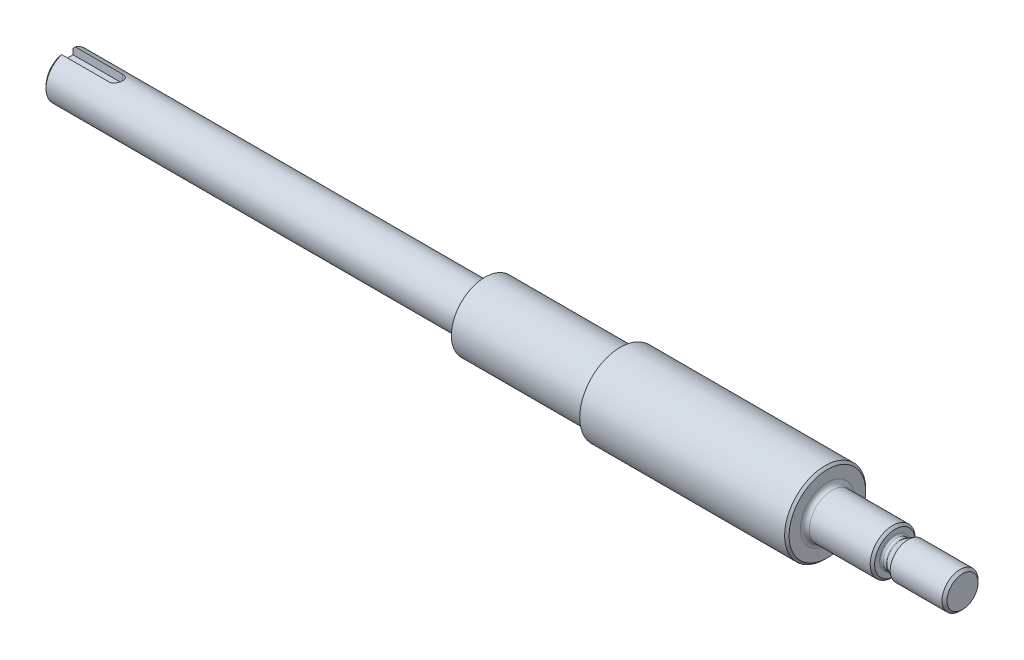
from build123d import *

# Parameters (mm, degrees)
CUT_EXTRUDE1_START  = 3
CUT_EXTRUDE1_DEPTH  = 10
FILLET1_R           = 1
CHAMFER1_SIZE       = 0.5
CHAMFER2_SIZE       = 0.5
SKETCH3_R           = 4.1
BOSS_EXTRUDE1_DEPTH = 15


# Read off the part's stored shape, not the designer's step: M8x1.0 Machine Threads Stud1
with BuildPart() as part:
    # Sketch1 → Revolve1 (revolve)
    with BuildSketch(Plane(origin=(0, 0, 0), x_dir=(1, 0, 0), z_dir=(0, 1, 0))):
        Polygon((0, 0), (0, -5), (93, -5), (93, -7.5), (123, -7.5), (123, -9), (169, -9), (169, -5), (184, -5), (184, 0), align=None)
    revolve(axis=Axis((0, 0, 0), (1, 0, 0)))

    # Sketch2 → Cut-Extrude1 (cut)
    with BuildSketch(Plane(origin=(0, 0, 0), x_dir=(1, 0, 0), z_dir=(0, 1, 0)).offset(CUT_EXTRUDE1_START)):
        with BuildLine():
            Line((-11, -1.5), (11, -1.5))
            ThreePointArc((11, -1.5), (12.5, 0), (11, 1.5))
            Line((11, 1.5), (-11, 1.5))
            Line((-11, 1.5), (-11, -1.5))
        make_face()
    extrude(amount=CUT_EXTRUDE1_DEPTH, mode=Mode.SUBTRACT)

    # Fillet1
    fillet1_edges = [part.edges().sort_by_distance(p)[0] for p in [
        (123, 0, -7.5),
        (93, 0, -5),
        (169, 0, -5),
    ]]
    fillet(fillet1_edges, radius=FILLET1_R)

    # Chamfer1
    chamfer1_edges = [part.edges().sort_by_distance(p)[0] for p in [
        (0, -4.031128874, -2.958039892),
    ]]
    chamfer(chamfer1_edges, length=CHAMFER1_SIZE)

    # Chamfer2
    chamfer2_edges = [part.edges().sort_by_distance(p)[0] for p in [
        (184, 0, -5),
        (169, 0, -9),
    ]]
    chamfer(chamfer2_edges, length=CHAMFER2_SIZE)

    # Sketch3 → Boss-Extrude1 (add)
    with BuildSketch(Plane(origin=(184, 0, 0), x_dir=(0, 0, -1), z_dir=(1, 0, 0))):
        Circle(SKETCH3_R)
    extrude(amount=BOSS_EXTRUDE1_DEPTH)

    # M8x1.0 Machine Threads Stud1 outline → M8x1.0 Machine Threads Stud1 (revolve, cut)
    with BuildSketch(Plane.YX):
        with BuildLine():
            ThreePointArc((3, 184.4), (3.117157288, 184.117157288), (3.4, 184))
            Line((3.4, 184), (4.1, 184))
            Line((4.1, 184), (4.1, 199))
            Line((4.1, 199), (3.4455, 199))
            Line((3.4455, 199), (4, 198.4455))
            Line((4, 198.4455), (4, 186.939230485))
            Line((4, 186.939230485), (3.053589838, 185.3))
            ThreePointArc((3.053589838, 185.3), (3.013629669, 185.203527618), (3, 185.1))
            Line((3, 185.1), (3, 184.4))
        make_face()
    revolve(axis=Axis((0, 0, 0), (1, 0, 0)), mode=Mode.SUBTRACT)


solid = part.part
